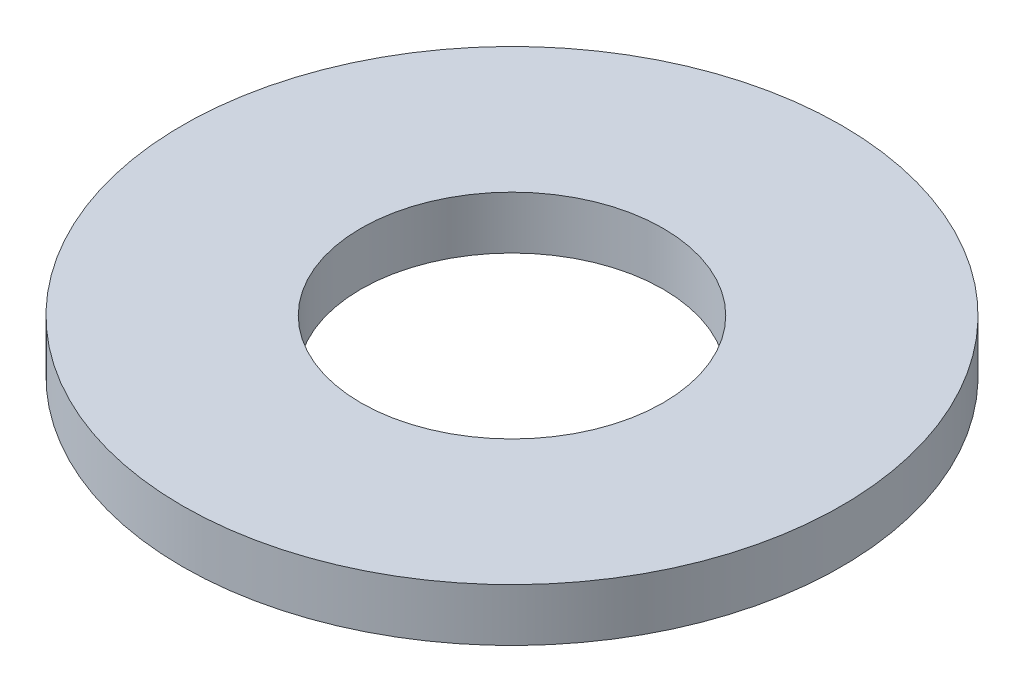
from build123d import *

# Parameters (mm, degrees)
SKETCH1_R           = 9.525
BOSS_EXTRUDE1_DEPTH = 1.524
SKETCH5_R           = 4.3688
CUT_EXTRUDE1_DEPTH  = 14.556320518


with BuildPart() as part:
    # Sketch1 → Boss-Extrude1 (new body)
    with BuildSketch(Plane(origin=(0, 0, 0), x_dir=(1, 0, 0), z_dir=(0, 1, 0))):
        Circle(SKETCH1_R)
    extrude(amount=BOSS_EXTRUDE1_DEPTH)

    # Sketch5 → Cut-Extrude1 (cut, through all)
    with BuildSketch(Plane(origin=(0, 1.524, 0), x_dir=(-1, 0, 0), z_dir=(0, 1, 0))):
        Circle(SKETCH5_R)
    extrude(amount=-CUT_EXTRUDE1_DEPTH, mode=Mode.SUBTRACT)


solid = part.part
